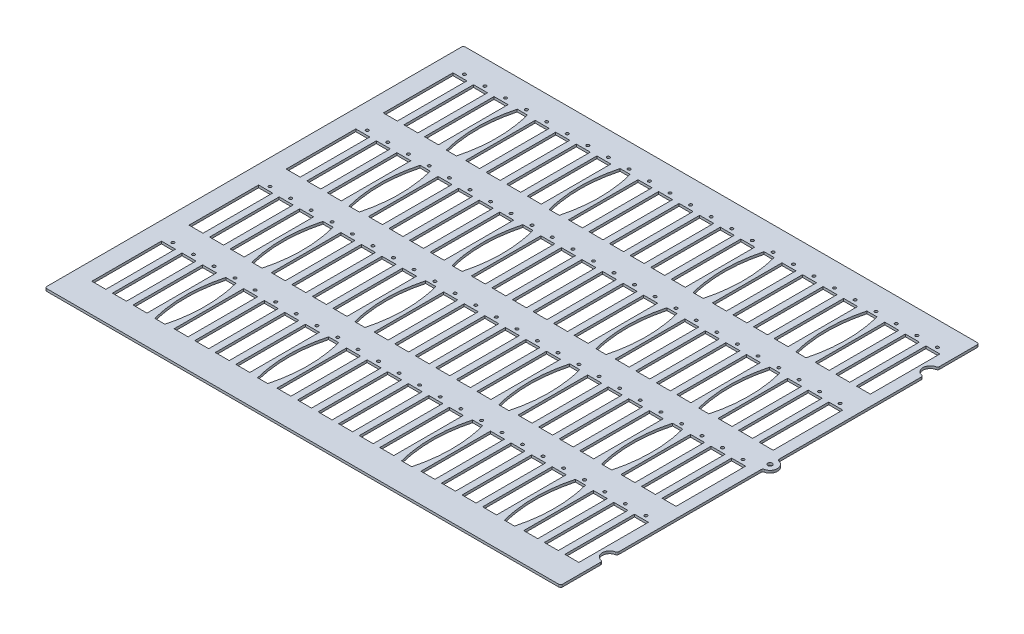
from build123d import *

# Parameters (mm, degrees)
BOSS_EXTRUDE1_DEPTH        = 3.175
SKETCH2_R                  = 1.905
SKETCH2_W                  = 18.288
SKETCH2_H                  = 90.932
CUT_EXTRUDE1_DEPTH         = 3.175
SKETCH3_R                  = 1.905
CUT_EXTRUDE2_DEPTH         = 3.175
F_1_0_228_DIAMETER_HOLE2_D = 5.7912
FILLET2_R                  = 2.54


with BuildPart() as part:
    # Sketch1 → Boss-Extrude1 (new body)
    with BuildSketch(Plane(origin=(0, 0, 0), x_dir=(1, 0, 0), z_dir=(0, 1, 0))):
        with BuildLine():
            Line((337.058, 219.456), (337.058, 273.558))
            Line((337.058, 273.558), (-337.058, 273.558))
            Line((-337.058, 273.558), (-337.058, -273.558))
            Line((-337.058, -273.558), (337.058, -273.558))
            Line((337.058, -273.558), (337.058, -218.948))
            ThreePointArc((337.058, -218.948), (327.406, -209.296), (337.058, -199.644))
            Line((337.058, -199.644), (337.058, -9.398))
            ThreePointArc((337.058, -9.398), (346.71, 0.254), (337.058, 9.906))
            Line((337.058, 9.906), (337.058, 200.152))
            ThreePointArc((337.058, 200.152), (327.406, 209.804), (337.058, 219.456))
        make_face()
    extrude(amount=BOSS_EXTRUDE1_DEPTH)

    # Sketch2 → Cut-Extrude1 (cut)
    with BuildSketch(Plane(origin=(0, 3.175, 0), x_dir=(1, 0, 0), z_dir=(0, 1, 0))):
        with Locations((-304.313166667, 242.062)):
            Circle(SKETCH2_R)
        with Locations((-277.4315, 242.062)):
            Circle(SKETCH2_R)
        with Locations((-250.549833333, 242.062)):
            Circle(SKETCH2_R)
        with Locations((-196.7865, 242.062)):
            Circle(SKETCH2_R)
        with Locations((-169.904833333, 242.062)):
            Circle(SKETCH2_R)
        with Locations((-143.023166667, 242.062)):
            Circle(SKETCH2_R)
        with Locations((-116.1415, 242.062)):
            Circle(SKETCH2_R)
        with Locations((-62.378166667, 242.062)):
            Circle(SKETCH2_R)
        with Locations((-35.4965, 242.062)):
            Circle(SKETCH2_R)
        with Locations((-8.614833333, 242.062)):
            Circle(SKETCH2_R)
        with Locations((18.266833333, 242.062)):
            Circle(SKETCH2_R)
        with Locations((45.1485, 242.062)):
            Circle(SKETCH2_R)
        with Locations((72.030166667, 242.062)):
            Circle(SKETCH2_R)
        with Locations((125.7935, 242.062)):
            Circle(SKETCH2_R)
        with Locations((152.675166667, 242.062)):
            Circle(SKETCH2_R)
        with Locations((179.556833333, 242.062)):
            Circle(SKETCH2_R)
        with Locations((206.4385, 242.062)):
            Circle(SKETCH2_R)
        with Locations((260.201833333, 242.062)):
            Circle(SKETCH2_R)
        with Locations((287.0835, 242.062)):
            Circle(SKETCH2_R)
        with Locations((313.965166667, 242.062)):
            Circle(SKETCH2_R)
        with Locations((-277.4315, 115.062)):
            Circle(SKETCH2_R)
        with Locations((-250.549833333, 115.062)):
            Circle(SKETCH2_R)
        with Locations((-196.7865, 115.062)):
            Circle(SKETCH2_R)
        with Locations((-169.904833333, 115.062)):
            Circle(SKETCH2_R)
        with Locations((-143.023166667, 115.062)):
            Circle(SKETCH2_R)
        with Locations((-116.1415, 115.062)):
            Circle(SKETCH2_R)
        with Locations((-62.378166667, 115.062)):
            Circle(SKETCH2_R)
        with Locations((-35.4965, 115.062)):
            Circle(SKETCH2_R)
        with Locations((-8.614833333, 115.062)):
            Circle(SKETCH2_R)
        with Locations((18.266833333, 115.062)):
            Circle(SKETCH2_R)
        with Locations((45.1485, 115.062)):
            Circle(SKETCH2_R)
        with Locations((72.030166667, 115.062)):
            Circle(SKETCH2_R)
        with Locations((125.7935, 115.062)):
            Circle(SKETCH2_R)
        with Locations((152.675166667, 115.062)):
            Circle(SKETCH2_R)
        with Locations((179.556833333, 115.062)):
            Circle(SKETCH2_R)
        with Locations((206.4385, 115.062)):
            Circle(SKETCH2_R)
        with Locations((260.201833333, 115.062)):
            Circle(SKETCH2_R)
        with Locations((287.0835, 115.062)):
            Circle(SKETCH2_R)
        with Locations((313.965166667, 115.062)):
            Circle(SKETCH2_R)
        with Locations((-277.4315, -11.938)):
            Circle(SKETCH2_R)
        with Locations((-250.549833333, -11.938)):
            Circle(SKETCH2_R)
        with Locations((-196.7865, -11.938)):
            Circle(SKETCH2_R)
        with Locations((-169.904833333, -11.938)):
            Circle(SKETCH2_R)
        with Locations((-143.023166667, -11.938)):
            Circle(SKETCH2_R)
        with Locations((-116.1415, -11.938)):
            Circle(SKETCH2_R)
        with Locations((-62.378166667, -11.938)):
            Circle(SKETCH2_R)
        with Locations((-35.4965, -11.938)):
            Circle(SKETCH2_R)
        with Locations((-8.614833333, -11.938)):
            Circle(SKETCH2_R)
        with Locations((18.266833333, -11.938)):
            Circle(SKETCH2_R)
        with Locations((45.1485, -11.938)):
            Circle(SKETCH2_R)
        with Locations((72.030166667, -11.938)):
            Circle(SKETCH2_R)
        with Locations((125.7935, -11.938)):
            Circle(SKETCH2_R)
        with Locations((152.675166667, -11.938)):
            Circle(SKETCH2_R)
        with Locations((179.556833333, -11.938)):
            Circle(SKETCH2_R)
        with Locations((206.4385, -11.938)):
            Circle(SKETCH2_R)
        with Locations((260.201833333, -11.938)):
            Circle(SKETCH2_R)
        with Locations((287.0835, -11.938)):
            Circle(SKETCH2_R)
        with Locations((313.965166667, -11.938)):
            Circle(SKETCH2_R)
        with Locations((-277.4315, -138.938)):
            Circle(SKETCH2_R)
        with Locations((-250.549833333, -138.938)):
            Circle(SKETCH2_R)
        with Locations((-196.7865, -138.938)):
            Circle(SKETCH2_R)
        with Locations((-169.904833333, -138.938)):
            Circle(SKETCH2_R)
        with Locations((-143.023166667, -138.938)):
            Circle(SKETCH2_R)
        with Locations((-116.1415, -138.938)):
            Circle(SKETCH2_R)
        with Locations((-62.378166667, -138.938)):
            Circle(SKETCH2_R)
        with Locations((-35.4965, -138.938)):
            Circle(SKETCH2_R)
        with Locations((-8.614833333, -138.938)):
            Circle(SKETCH2_R)
        with Locations((18.266833333, -138.938)):
            Circle(SKETCH2_R)
        with Locations((45.1485, -138.938)):
            Circle(SKETCH2_R)
        with Locations((72.030166667, -138.938)):
            Circle(SKETCH2_R)
        with Locations((125.7935, -138.938)):
            Circle(SKETCH2_R)
        with Locations((152.675166667, -138.938)):
            Circle(SKETCH2_R)
        with Locations((179.556833333, -138.938)):
            Circle(SKETCH2_R)
        with Locations((206.4385, -138.938)):
            Circle(SKETCH2_R)
        with Locations((260.201833333, -138.938)):
            Circle(SKETCH2_R)
        with Locations((287.0835, -138.938)):
            Circle(SKETCH2_R)
        with Locations((313.965166667, -138.938)):
            Circle(SKETCH2_R)
        with Locations((-304.313166667, 115.062)):
            Circle(SKETCH2_R)
        with Locations((-304.313166667, -11.938)):
            Circle(SKETCH2_R)
        with Locations((-304.313166667, -138.938)):
            Circle(SKETCH2_R)
        with Locations((-277.4315, 190.754)):
            Rectangle(SKETCH2_W, SKETCH2_H)
        with Locations((-304.313166667, 190.754)):
            Rectangle(SKETCH2_W, SKETCH2_H)
        with Locations((-250.549833333, 190.754)):
            Rectangle(SKETCH2_W, SKETCH2_H)
        with Locations((-196.7865, 190.754)):
            Rectangle(SKETCH2_W, SKETCH2_H)
        with Locations((-169.904833333, 190.754)):
            Rectangle(SKETCH2_W, SKETCH2_H)
        with Locations((-143.023166667, 190.754)):
            Rectangle(SKETCH2_W, SKETCH2_H)
        with Locations((-116.1415, 190.754)):
            Rectangle(SKETCH2_W, SKETCH2_H)
        with Locations((-62.378166667, 190.754)):
            Rectangle(SKETCH2_W, SKETCH2_H)
        with Locations((-35.4965, 190.754)):
            Rectangle(SKETCH2_W, SKETCH2_H)
        with Locations((-8.614833333, 190.754)):
            Rectangle(SKETCH2_W, SKETCH2_H)
        with Locations((18.266833333, 190.754)):
            Rectangle(SKETCH2_W, SKETCH2_H)
        with Locations((45.1485, 190.754)):
            Rectangle(SKETCH2_W, SKETCH2_H)
        with Locations((72.030166667, 190.754)):
            Rectangle(SKETCH2_W, SKETCH2_H)
        with Locations((125.7935, 190.754)):
            Rectangle(SKETCH2_W, SKETCH2_H)
        with Locations((152.675166667, 190.754)):
            Rectangle(SKETCH2_W, SKETCH2_H)
        with Locations((179.556833333, 190.754)):
            Rectangle(SKETCH2_W, SKETCH2_H)
        with Locations((206.4385, 190.754)):
            Rectangle(SKETCH2_W, SKETCH2_H)
        with Locations((260.201833333, 190.754)):
            Rectangle(SKETCH2_W, SKETCH2_H)
        with Locations((287.0835, 190.754)):
            Rectangle(SKETCH2_W, SKETCH2_H)
        with Locations((313.965166667, 190.754)):
            Rectangle(SKETCH2_W, SKETCH2_H)
        with Locations((-277.4315, 63.754)):
            Rectangle(SKETCH2_W, SKETCH2_H)
        with Locations((-250.549833333, 63.754)):
            Rectangle(SKETCH2_W, SKETCH2_H)
        with Locations((-196.7865, 63.754)):
            Rectangle(SKETCH2_W, SKETCH2_H)
        with Locations((-169.904833333, 63.754)):
            Rectangle(SKETCH2_W, SKETCH2_H)
        with Locations((-143.023166667, 63.754)):
            Rectangle(SKETCH2_W, SKETCH2_H)
        with Locations((-116.1415, 63.754)):
            Rectangle(SKETCH2_W, SKETCH2_H)
        with Locations((-62.378166667, 63.754)):
            Rectangle(SKETCH2_W, SKETCH2_H)
        with Locations((-35.4965, 63.754)):
            Rectangle(SKETCH2_W, SKETCH2_H)
        with Locations((-8.614833333, 63.754)):
            Rectangle(SKETCH2_W, SKETCH2_H)
        with Locations((18.266833333, 63.754)):
            Rectangle(SKETCH2_W, SKETCH2_H)
        with Locations((45.1485, 63.754)):
            Rectangle(SKETCH2_W, SKETCH2_H)
        with Locations((72.030166667, 63.754)):
            Rectangle(SKETCH2_W, SKETCH2_H)
        with Locations((125.7935, 63.754)):
            Rectangle(SKETCH2_W, SKETCH2_H)
        with Locations((152.675166667, 63.754)):
            Rectangle(SKETCH2_W, SKETCH2_H)
        with Locations((179.556833333, 63.754)):
            Rectangle(SKETCH2_W, SKETCH2_H)
        with Locations((206.4385, 63.754)):
            Rectangle(SKETCH2_W, SKETCH2_H)
        with Locations((260.201833333, 63.754)):
            Rectangle(SKETCH2_W, SKETCH2_H)
        with Locations((287.0835, 63.754)):
            Rectangle(SKETCH2_W, SKETCH2_H)
        with Locations((313.965166667, 63.754)):
            Rectangle(SKETCH2_W, SKETCH2_H)
        with Locations((-277.4315, -63.246)):
            Rectangle(SKETCH2_W, SKETCH2_H)
        with Locations((-250.549833333, -63.246)):
            Rectangle(SKETCH2_W, SKETCH2_H)
        with Locations((-196.7865, -63.246)):
            Rectangle(SKETCH2_W, SKETCH2_H)
        with Locations((-169.904833333, -63.246)):
            Rectangle(SKETCH2_W, SKETCH2_H)
        with Locations((-143.023166667, -63.246)):
            Rectangle(SKETCH2_W, SKETCH2_H)
        with Locations((-116.1415, -63.246)):
            Rectangle(SKETCH2_W, SKETCH2_H)
        with Locations((-62.378166667, -63.246)):
            Rectangle(SKETCH2_W, SKETCH2_H)
        with Locations((-35.4965, -63.246)):
            Rectangle(SKETCH2_W, SKETCH2_H)
        with Locations((-8.614833333, -63.246)):
            Rectangle(SKETCH2_W, SKETCH2_H)
        with Locations((18.266833333, -63.246)):
            Rectangle(SKETCH2_W, SKETCH2_H)
        with Locations((45.1485, -63.246)):
            Rectangle(SKETCH2_W, SKETCH2_H)
        with Locations((72.030166667, -63.246)):
            Rectangle(SKETCH2_W, SKETCH2_H)
        with Locations((125.7935, -63.246)):
            Rectangle(SKETCH2_W, SKETCH2_H)
        with Locations((152.675166667, -63.246)):
            Rectangle(SKETCH2_W, SKETCH2_H)
        with Locations((179.556833333, -63.246)):
            Rectangle(SKETCH2_W, SKETCH2_H)
        with Locations((206.4385, -63.246)):
            Rectangle(SKETCH2_W, SKETCH2_H)
        with Locations((260.201833333, -63.246)):
            Rectangle(SKETCH2_W, SKETCH2_H)
        with Locations((287.0835, -63.246)):
            Rectangle(SKETCH2_W, SKETCH2_H)
        with Locations((313.965166667, -63.246)):
            Rectangle(SKETCH2_W, SKETCH2_H)
        with Locations((-277.4315, -190.246)):
            Rectangle(SKETCH2_W, SKETCH2_H)
        with Locations((-250.549833333, -190.246)):
            Rectangle(SKETCH2_W, SKETCH2_H)
        with Locations((-196.7865, -190.246)):
            Rectangle(SKETCH2_W, SKETCH2_H)
        with Locations((-169.904833333, -190.246)):
            Rectangle(SKETCH2_W, SKETCH2_H)
        with Locations((-143.023166667, -190.246)):
            Rectangle(SKETCH2_W, SKETCH2_H)
        with Locations((-116.1415, -190.246)):
            Rectangle(SKETCH2_W, SKETCH2_H)
        with Locations((-62.378166667, -190.246)):
            Rectangle(SKETCH2_W, SKETCH2_H)
        with Locations((-35.4965, -190.246)):
            Rectangle(SKETCH2_W, SKETCH2_H)
        with Locations((-8.614833333, -190.246)):
            Rectangle(SKETCH2_W, SKETCH2_H)
        with Locations((18.266833333, -190.246)):
            Rectangle(SKETCH2_W, SKETCH2_H)
        with Locations((45.1485, -190.246)):
            Rectangle(SKETCH2_W, SKETCH2_H)
        with Locations((72.030166667, -190.246)):
            Rectangle(SKETCH2_W, SKETCH2_H)
        with Locations((125.7935, -190.246)):
            Rectangle(SKETCH2_W, SKETCH2_H)
        with Locations((152.675166667, -190.246)):
            Rectangle(SKETCH2_W, SKETCH2_H)
        with Locations((179.556833333, -190.246)):
            Rectangle(SKETCH2_W, SKETCH2_H)
        with Locations((206.4385, -190.246)):
            Rectangle(SKETCH2_W, SKETCH2_H)
        with Locations((260.201833333, -190.246)):
            Rectangle(SKETCH2_W, SKETCH2_H)
        with Locations((287.0835, -190.246)):
            Rectangle(SKETCH2_W, SKETCH2_H)
        with Locations((313.965166667, -190.246)):
            Rectangle(SKETCH2_W, SKETCH2_H)
        with Locations((-304.313166667, 63.754)):
            Rectangle(SKETCH2_W, SKETCH2_H)
        with Locations((-304.313166667, -63.246)):
            Rectangle(SKETCH2_W, SKETCH2_H)
        with Locations((-304.313166667, -190.246)):
            Rectangle(SKETCH2_W, SKETCH2_H)
    extrude(amount=-CUT_EXTRUDE1_DEPTH, mode=Mode.SUBTRACT)

    # Sketch3 → Cut-Extrude2 (cut)
    with BuildSketch(Plane(origin=(0, 3.175, 0), x_dir=(1, 0, 0), z_dir=(0, 1, 0))):
        with Locations((-223.668166667, 242.443)):
            Circle(SKETCH3_R)
        with Locations((-89.259833333, 242.443)):
            Circle(SKETCH3_R)
        with Locations((-89.259833333, 115.443)):
            Circle(SKETCH3_R)
        with Locations((-89.259833333, -11.557)):
            Circle(SKETCH3_R)
        with Locations((-89.259833333, -138.557)):
            Circle(SKETCH3_R)
        with Locations((-223.668166667, 115.443)):
            Circle(SKETCH3_R)
        with Locations((-223.668166667, -11.557)):
            Circle(SKETCH3_R)
        with Locations((-223.668166667, -138.557)):
            Circle(SKETCH3_R)
        with Locations((98.911833333, 242.443)):
            Circle(SKETCH3_R)
        with Locations((98.911833333, 115.443)):
            Circle(SKETCH3_R)
        with Locations((98.911833333, -11.557)):
            Circle(SKETCH3_R)
        with Locations((98.911833333, -138.557)):
            Circle(SKETCH3_R)
        with Locations((233.320166667, 242.443)):
            Circle(SKETCH3_R)
        with Locations((233.320166667, 115.443)):
            Circle(SKETCH3_R)
        with Locations((233.320166667, -11.557)):
            Circle(SKETCH3_R)
        with Locations((233.320166667, -138.557)):
            Circle(SKETCH3_R)
        with BuildLine():
            Line((-95.863833333, 237.109), (-82.655833333, 237.109))
            add(Edge.make_bspline(
                [(-82.655833333, 237.109), (-70.463833333, 190.754), (-82.655833333, 144.399)],
                knots=[0, 0, 0, 1, 1, 1], degree=2))
            Line((-82.655833333, 144.399), (-95.863833333, 144.399))
            add(Edge.make_bspline(
                [(-95.863833333, 237.109), (-108.055833333, 190.754), (-95.863833333, 144.399)],
                knots=[0, 0, 0, 1, 1, 1], degree=2))
        make_face()
        with BuildLine():
            Line((-230.272166667, 144.399), (-217.064166667, 144.399))
            add(Edge.make_bspline(
                [(-217.064166667, 237.109), (-204.872166667, 190.754), (-217.064166667, 144.399)],
                knots=[0, 0, 0, 1, 1, 1], degree=2))
            Line((-217.064166667, 237.109), (-230.272166667, 237.109))
            add(Edge.make_bspline(
                [(-230.272166667, 237.109), (-242.464166667, 190.754), (-230.272166667, 144.399)],
                knots=[0, 0, 0, 1, 1, 1], degree=2))
        make_face()
        with BuildLine():
            Line((-95.863833333, 110.109), (-82.655833333, 110.109))
            add(Edge.make_bspline(
                [(-82.655833333, 110.109), (-70.463833333, 63.754), (-82.655833333, 17.399)],
                knots=[0, 0, 0, 1, 1, 1], degree=2))
            Line((-82.655833333, 17.399), (-95.863833333, 17.399))
            add(Edge.make_bspline(
                [(-95.863833333, 110.109), (-108.055833333, 63.754), (-95.863833333, 17.399)],
                knots=[0, 0, 0, 1, 1, 1], degree=2))
        make_face()
        with BuildLine():
            Line((-95.863833333, -16.891), (-82.655833333, -16.891))
            add(Edge.make_bspline(
                [(-82.655833333, -16.891), (-70.463833333, -63.246), (-82.655833333, -109.601)],
                knots=[0, 0, 0, 1, 1, 1], degree=2))
            Line((-82.655833333, -109.601), (-95.863833333, -109.601))
            add(Edge.make_bspline(
                [(-95.863833333, -16.891), (-108.055833333, -63.246), (-95.863833333, -109.601)],
                knots=[0, 0, 0, 1, 1, 1], degree=2))
        make_face()
        with BuildLine():
            Line((-95.863833333, -143.891), (-82.655833333, -143.891))
            add(Edge.make_bspline(
                [(-82.655833333, -143.891), (-70.463833333, -190.246), (-82.655833333, -236.601)],
                knots=[0, 0, 0, 1, 1, 1], degree=2))
            Line((-82.655833333, -236.601), (-95.863833333, -236.601))
            add(Edge.make_bspline(
                [(-95.863833333, -143.891), (-108.055833333, -190.246), (-95.863833333, -236.601)],
                knots=[0, 0, 0, 1, 1, 1], degree=2))
        make_face()
        with BuildLine():
            Line((-230.272166667, 110.109), (-217.064166667, 110.109))
            add(Edge.make_bspline(
                [(-217.064166667, 110.109), (-204.872166667, 63.754), (-217.064166667, 17.399)],
                knots=[0, 0, 0, 1, 1, 1], degree=2))
            Line((-217.064166667, 17.399), (-230.272166667, 17.399))
            add(Edge.make_bspline(
                [(-230.272166667, 110.109), (-242.464166667, 63.754), (-230.272166667, 17.399)],
                knots=[0, 0, 0, 1, 1, 1], degree=2))
        make_face()
        with BuildLine():
            Line((-230.272166667, -16.891), (-217.064166667, -16.891))
            add(Edge.make_bspline(
                [(-217.064166667, -16.891), (-204.872166667, -63.246), (-217.064166667, -109.601)],
                knots=[0, 0, 0, 1, 1, 1], degree=2))
            Line((-217.064166667, -109.601), (-230.272166667, -109.601))
            add(Edge.make_bspline(
                [(-230.272166667, -16.891), (-242.464166667, -63.246), (-230.272166667, -109.601)],
                knots=[0, 0, 0, 1, 1, 1], degree=2))
        make_face()
        with BuildLine():
            Line((-230.272166667, -143.891), (-217.064166667, -143.891))
            add(Edge.make_bspline(
                [(-217.064166667, -143.891), (-204.872166667, -190.246), (-217.064166667, -236.601)],
                knots=[0, 0, 0, 1, 1, 1], degree=2))
            Line((-217.064166667, -236.601), (-230.272166667, -236.601))
            add(Edge.make_bspline(
                [(-230.272166667, -143.891), (-242.464166667, -190.246), (-230.272166667, -236.601)],
                knots=[0, 0, 0, 1, 1, 1], degree=2))
        make_face()
        with BuildLine():
            Line((92.307833333, 237.109), (105.515833333, 237.109))
            add(Edge.make_bspline(
                [(105.515833333, 237.109), (117.707833333, 190.754), (105.515833333, 144.399)],
                knots=[0, 0, 0, 1, 1, 1], degree=2))
            Line((105.515833333, 144.399), (92.307833333, 144.399))
            add(Edge.make_bspline(
                [(92.307833333, 237.109), (80.115833333, 190.754), (92.307833333, 144.399)],
                knots=[0, 0, 0, 1, 1, 1], degree=2))
        make_face()
        with BuildLine():
            Line((92.307833333, 110.109), (105.515833333, 110.109))
            add(Edge.make_bspline(
                [(105.515833333, 110.109), (117.707833333, 63.754), (105.515833333, 17.399)],
                knots=[0, 0, 0, 1, 1, 1], degree=2))
            Line((105.515833333, 17.399), (92.307833333, 17.399))
            add(Edge.make_bspline(
                [(92.307833333, 110.109), (80.115833333, 63.754), (92.307833333, 17.399)],
                knots=[0, 0, 0, 1, 1, 1], degree=2))
        make_face()
        with BuildLine():
            Line((92.307833333, -16.891), (105.515833333, -16.891))
            add(Edge.make_bspline(
                [(105.515833333, -16.891), (117.707833333, -63.246), (105.515833333, -109.601)],
                knots=[0, 0, 0, 1, 1, 1], degree=2))
            Line((105.515833333, -109.601), (92.307833333, -109.601))
            add(Edge.make_bspline(
                [(92.307833333, -16.891), (80.115833333, -63.246), (92.307833333, -109.601)],
                knots=[0, 0, 0, 1, 1, 1], degree=2))
        make_face()
        with BuildLine():
            Line((92.307833333, -143.891), (105.515833333, -143.891))
            add(Edge.make_bspline(
                [(105.515833333, -143.891), (117.707833333, -190.246), (105.515833333, -236.601)],
                knots=[0, 0, 0, 1, 1, 1], degree=2))
            Line((105.515833333, -236.601), (92.307833333, -236.601))
            add(Edge.make_bspline(
                [(92.307833333, -143.891), (80.115833333, -190.246), (92.307833333, -236.601)],
                knots=[0, 0, 0, 1, 1, 1], degree=2))
        make_face()
        with BuildLine():
            Line((226.716166667, 237.109), (239.924166667, 237.109))
            add(Edge.make_bspline(
                [(239.924166667, 237.109), (252.116166667, 190.754), (239.924166667, 144.399)],
                knots=[0, 0, 0, 1, 1, 1], degree=2))
            Line((239.924166667, 144.399), (226.716166667, 144.399))
            add(Edge.make_bspline(
                [(226.716166667, 237.109), (214.524166667, 190.754), (226.716166667, 144.399)],
                knots=[0, 0, 0, 1, 1, 1], degree=2))
        make_face()
        with BuildLine():
            Line((226.716166667, 110.109), (239.924166667, 110.109))
            add(Edge.make_bspline(
                [(239.924166667, 110.109), (252.116166667, 63.754), (239.924166667, 17.399)],
                knots=[0, 0, 0, 1, 1, 1], degree=2))
            Line((239.924166667, 17.399), (226.716166667, 17.399))
            add(Edge.make_bspline(
                [(226.716166667, 110.109), (214.524166667, 63.754), (226.716166667, 17.399)],
                knots=[0, 0, 0, 1, 1, 1], degree=2))
        make_face()
        with BuildLine():
            Line((226.716166667, -16.891), (239.924166667, -16.891))
            add(Edge.make_bspline(
                [(239.924166667, -16.891), (252.116166667, -63.246), (239.924166667, -109.601)],
                knots=[0, 0, 0, 1, 1, 1], degree=2))
            Line((239.924166667, -109.601), (226.716166667, -109.601))
            add(Edge.make_bspline(
                [(226.716166667, -16.891), (214.524166667, -63.246), (226.716166667, -109.601)],
                knots=[0, 0, 0, 1, 1, 1], degree=2))
        make_face()
        with BuildLine():
            Line((226.716166667, -143.891), (239.924166667, -143.891))
            add(Edge.make_bspline(
                [(239.924166667, -143.891), (252.116166667, -190.246), (239.924166667, -236.601)],
                knots=[0, 0, 0, 1, 1, 1], degree=2))
            Line((239.924166667, -236.601), (226.716166667, -236.601))
            add(Edge.make_bspline(
                [(226.716166667, -143.891), (214.524166667, -190.246), (226.716166667, -236.601)],
                knots=[0, 0, 0, 1, 1, 1], degree=2))
        make_face()
    extrude(amount=-CUT_EXTRUDE2_DEPTH, mode=Mode.SUBTRACT)

    # #1 (0.228) Diameter Hole2 (through all)
    with Locations(Plane(origin=(0, 3.175, 0), x_dir=(1, 0, 0), z_dir=(0, 1, 0))):
        with Locations((337.058, 0.254)):
            Hole(F_1_0_228_DIAMETER_HOLE2_D / 2)

    # Fillet2
    fillet2_edges = [part.edges().sort_by_distance(p)[0] for p in [
        (-337.058, 1.5875, -273.558),
        (-337.058, 1.5875, 273.558),
        (337.058, 1.5875, 273.558),
        (337.058, 1.5875, 218.948),
        (337.058, 1.5875, 199.644),
        (337.058, 1.5875, 9.398),
        (337.058, 1.5875, -9.906),
        (337.058, 1.5875, -200.152),
        (337.058, 1.5875, -219.456),
        (337.058, 1.5875, -273.558),
    ]]
    fillet(fillet2_edges, radius=FILLET2_R)


solid = part.part
